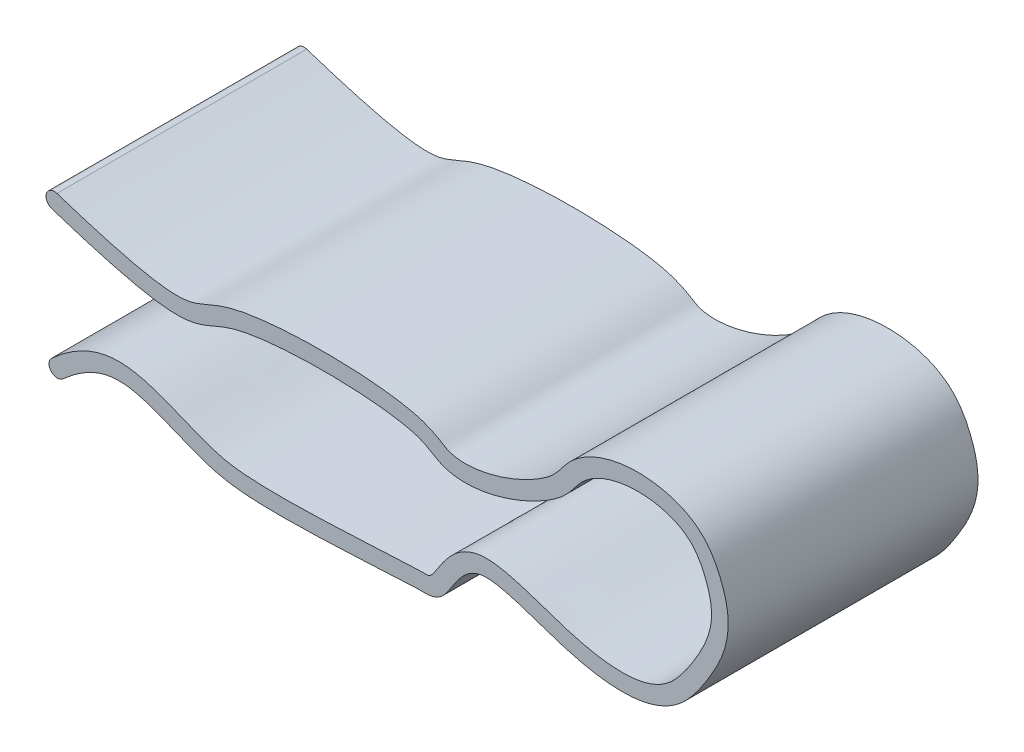
from build123d import *

# Parameters (mm, degrees)
BOSS_EXTRUDE3_DEPTH = 18


with BuildPart() as part:
    # Sketch1 → Boss-Extrude3 (new body)
    with BuildSketch(Plane.XY):
        with BuildLine():
            ThreePointArc((-11.245007787, -2.89132561), (-12.092397694, -2.847389907), (-12.048461991, -2))
            add(Edge.make_bspline(
                [(-12.048461991, -2), (-7.570088423, 2.036872752), (-4.417461863, -0.706583782), (2.812181046, -2.842811904), (14.331868368, -1.869060322), (15.63083972, -2.150931779), (17.084841284, 2.755045557), (30.019256206, -2.657124122), (33.041995524, 0.436304325), (35.227830418, 3.787085025), (36.1850149, 5.943303034), (33.273927096, 11.197453625), (27.062027372, 11.27632034), (24.459820747, 6.743571407), (17.367688575, 3.947987044), (13.868646858, 7.148870202), (-2.553016781, 7.332966333), (-1.383307996, 3.843374596), (-12.048461991, 7.324863972)],
                knots=[0, 0, 0, 0, 0.088285395, 0.098847049, 0.148924101, 0.160300535, 0.206351757, 0.2331113, 0.316348428, 0.349993996, 0.545169984, 0.587691624, 0.732688757, 0.763169124, 0.862014921, 0.88198857, 0.94293196, 1, 1, 1, 1], degree=3))
            ThreePointArc((-12.048461991, 7.324863972), (-12.432648936, 8.081435443), (-11.676077465, 8.465622389))
            add(Edge.make_bspline(
                [(-11.245007787, -2.89132561), (-11.071894091, -2.735278341), (-10.704279493, -2.421853509), (-10.037581203, -1.922662928), (-9.260334702, -1.460872119), (-8.427083166, -1.137174226), (-7.754819758, -1.006590806), (-7.21941956, -0.979526351), (-6.710969311, -1.001475719), (-5.831657196, -1.131994993), (-4.730614678, -1.487823341), (-3.472082731, -1.993157827), (-2.460128864, -2.410524002), (-1.366668511, -2.825307775), (-0.19819578, -3.230977106), (1.499693053, -3.521412289), (3.688793197, -3.606177614), (6.182901999, -3.584187758), (8.762618925, -3.488126814), (11.190991993, -3.362808652), (12.88698297, -3.268256709), (13.918274034, -3.219023818), (14.489933198, -3.202093471), (14.801089487, -3.203312266), (15.124539961, -3.21441522), (15.590522306, -3.10001256), (16.034226392, -2.847095653), (16.311587831, -2.537074565), (16.544125667, -2.218914882), (16.750070754, -1.898885028), (16.95831967, -1.576469011), (17.252346051, -1.151208102), (17.664786228, -0.660789113), (18.226360689, -0.241059347), (18.755971979, -0.060225963), (19.220303034, -0.023899437), (19.557377244, -0.033686768), (20.226528631, -0.113446332), (21.452178437, -0.426119845), (23.155112127, -1.008397207), (25.451848704, -1.785503661), (27.882198262, -2.287041173), (30.183254211, -2.284629456), (31.982376543, -1.777691721), (33.277045417, -0.929291512), (34.096062384, -0.027022168), (34.589835972, 0.630391339), (34.978140372, 1.20872916), (35.282052016, 1.698143215), (35.679996545, 2.363306658), (36.118453947, 3.198008805), (36.517759872, 4.267079957), (36.719256109, 5.431821422), (36.661039825, 6.67175172), (36.375277081, 7.75273144), (36.019610712, 8.630767286), (35.654668684, 9.362638716), (35.123031937, 10.135010184), (34.077913952, 11.094387896), (32.443855251, 11.801353229), (30.246904049, 12.094621483), (28.369710497, 11.872620216), (26.950607463, 11.377154266), (26.122917396, 10.913109874), (25.524178875, 10.445077553), (24.962500966, 9.881011064), (24.498272895, 9.233985507), (23.989588867, 8.663250353), (23.008671995, 7.957460084), (21.708184237, 7.275939608), (20.247353249, 6.716751856), (18.775266937, 6.360733789), (17.684984273, 6.289682953), (17.11519465, 6.356132768), (16.848243627, 6.412621268), (16.700608335, 6.454161443), (16.472969084, 6.536849284), (16.23927767, 6.662029168), (15.551410358, 7.097962671), (14.456015865, 7.549482966), (13.021176063, 7.847217218), (11.316554214, 8.056185576), (8.771846165, 8.218930194), (6.019066666, 8.211910968), (3.45477171, 8.020044819), (1.727312877, 7.782589192), (0.242841101, 7.41192625), (-0.831114162, 6.951306719), (-1.498637804, 6.66095062), (-2.003722105, 6.511999081), (-2.556363686, 6.41888994), (-3.316138498, 6.397992606), (-4.272663784, 6.503412193), (-4.942820655, 6.617029301), (-5.561634229, 6.734905197), (-6.459377181, 6.932485755), (-7.836851484, 7.290374655), (-9.043226751, 7.639956944), (-9.975582516, 7.924089523), (-10.703249844, 8.151098911), (-11.328063921, 8.352018266), (-11.676077465, 8.465622389)],
                knots=[0, 0, 0, 0, 0.00390625, 0.0078125, 0.015625, 0.0234375, 0.03125, 0.036089832, 0.039996082, 0.046875, 0.0625, 0.0703125, 0.078125, 0.0859375, 0.09375, 0.1015625, 0.109375, 0.1171875, 0.125, 0.1328125, 0.140625, 0.14453125, 0.1484375, 0.15234375, 0.15625, 0.158203125, 0.16015625, 0.1640625, 0.16796875, 0.171875, 0.17578125, 0.1796875, 0.1875, 0.1953125, 0.203125, 0.205878436, 0.207831561, 0.2109375, 0.21875, 0.2265625, 0.234375, 0.25, 0.265625, 0.28125, 0.296875, 0.3125, 0.328125, 0.34375, 0.359375, 0.375, 0.40625, 0.4375, 0.46875, 0.5, 0.53125, 0.546875, 0.5625, 0.578125, 0.59375, 0.625, 0.65625, 0.6875, 0.703125, 0.71875, 0.7265625, 0.734375, 0.75, 0.765625, 0.78125, 0.796875, 0.8125, 0.828125, 0.84375, 0.851264368, 0.853217493, 0.857123743, 0.859375, 0.8671875, 0.875, 0.8828125, 0.890625, 0.8984375, 0.90625, 0.921875, 0.9296875, 0.9375, 0.9453125, 0.953125, 0.9609375, 0.965761346, 0.969667596, 0.9765625, 0.981528541, 0.983481666, 0.984458228, 0.98828125, 0.9921875, 0.995617208, 0.99659377, 0.998046875, 1, 1, 1, 1], degree=3))
        make_face()
    extrude(amount=BOSS_EXTRUDE3_DEPTH)


solid = part.part
